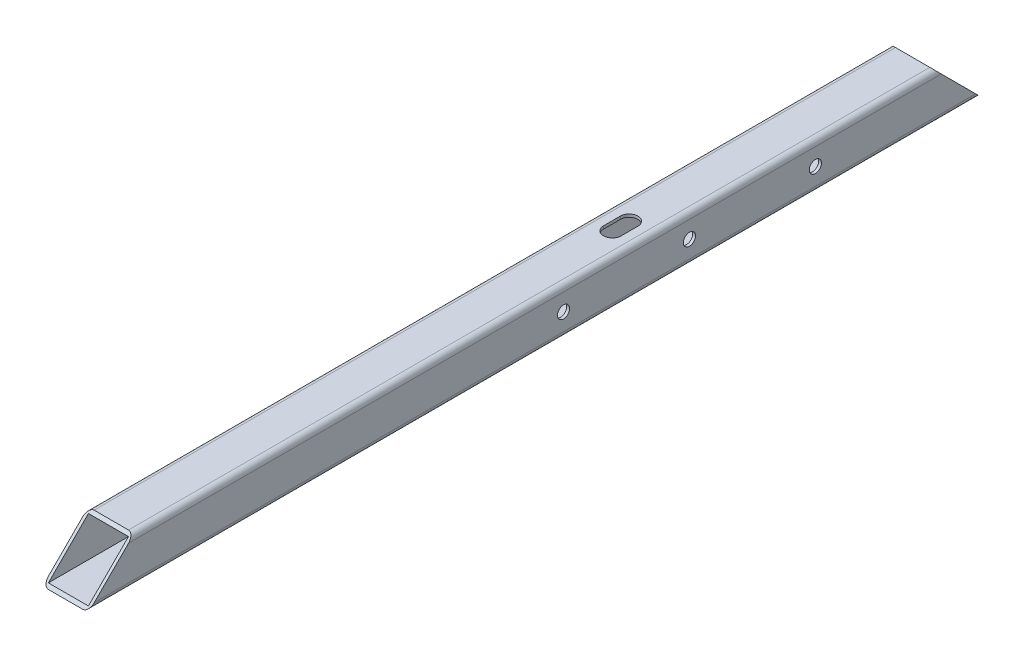
from build123d import *

# Parameters (mm, degrees)
SKETCH1_W                   = 50.8
SKETCH1_H                   = 50.8
SKETCH1_W_2                 = 44.45
SKETCH1_H_2                 = 44.45
BOSS_EXTRUDE1_DEPTH         = 495.3
FILLET1_R                   = 6.35
CUT_EXTRUDE1_DEPTH          = 914.4
F_1_2_CLEARANCE_HOLE1_D     = 13.49248
F_3_4_START                 = -25.4
F_3_4_CLEARANCE_SLOT1_DEPTH = 50.8


# Read off the part's stored shape, not the designer's step: 3/4 Clearance Slot1
with BuildPart() as part:
    # Sketch1 → Boss-Extrude1 (new, symmetric)
    with BuildSketch(Plane.XY):
        Rectangle(SKETCH1_W, SKETCH1_H)
        Rectangle(SKETCH1_W_2, SKETCH1_H_2, mode=Mode.SUBTRACT)
    extrude(amount=BOSS_EXTRUDE1_DEPTH, both=True)

    # Fillet1
    fillet1_edges = [part.edges().sort_by_distance(p)[0] for p in [
        (-25.4, 25.4, 0),
        (25.4, 25.4, 0),
        (25.4, -25.4, 0),
        (-25.4, -25.4, 0),
    ]]
    fillet(fillet1_edges, radius=FILLET1_R)

    # Sketch2 → Cut-Extrude1 (cut)
    with BuildSketch(Plane.ZY.offset(25.4)):
        Polygon((495.3, -25.4), (444.5, 25.4), (495.3, 25.4), align=None)
        Polygon((-495.3, 25.4), (-495.3, -25.4), (-444.5, 25.4), align=None)
    extrude(amount=-CUT_EXTRUDE1_DEPTH, mode=Mode.SUBTRACT)

    # 1/2 Clearance Hole1 (through all)
    with Locations(Plane.ZY.offset(25.4)):
        with Locations((-171.45, 0), (-311.15, 0), (-31.75, 0)):
            Hole(F_1_2_CLEARANCE_HOLE1_D / 2)

    # 3/4 Clearance Slot1 outline → 3/4 Clearance Slot1 (cut)
    with BuildSketch(Plane(origin=(0, 0, 0), x_dir=(1, 0, 0), z_dir=(0, 1, 0)).offset(F_3_4_START)):
        with BuildLine():
            ThreePointArc((9.72312, 129.97688), (0, 139.7), (-9.72312, 129.97688))
            Line((-9.72312, 129.97688), (-9.72312, 111.32312))
            ThreePointArc((-9.72312, 111.32312), (0, 101.6), (9.72312, 111.32312))
            Line((9.72312, 111.32312), (9.72312, 129.97688))
        make_face()
    extrude(amount=F_3_4_CLEARANCE_SLOT1_DEPTH, mode=Mode.SUBTRACT)


solid = part.part
